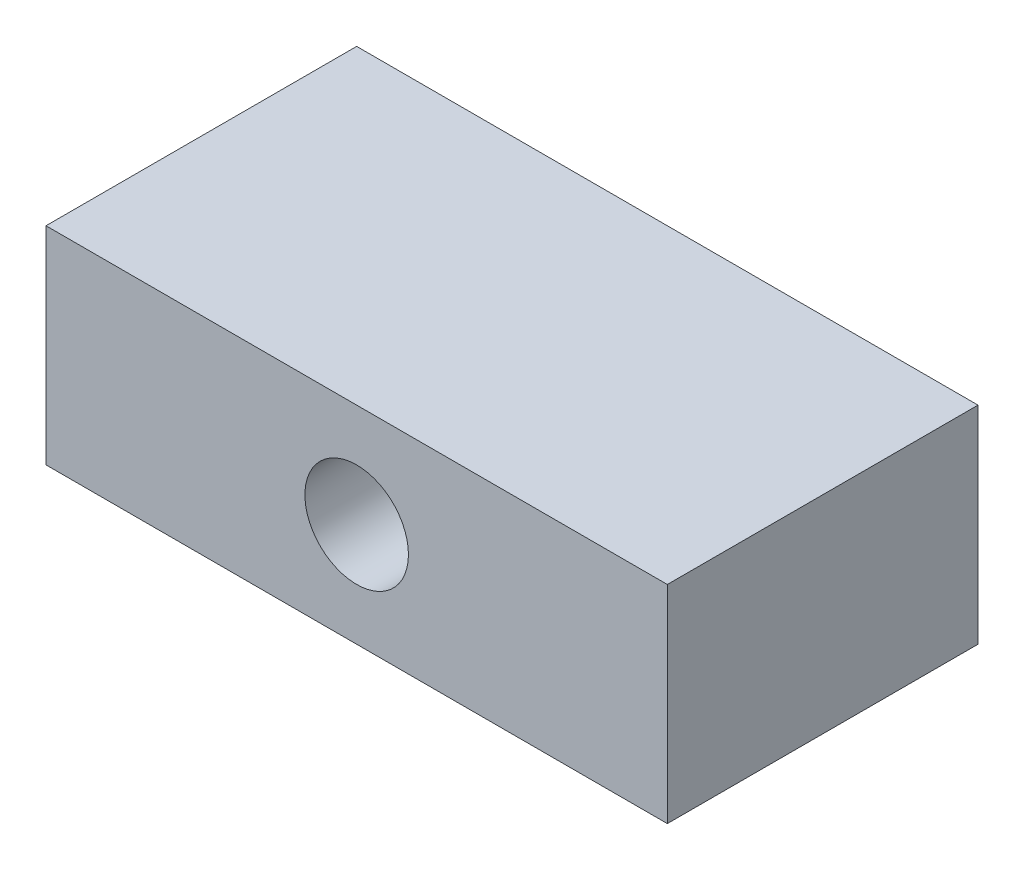
from build123d import *

# Parameters (mm, degrees)
SKETCH1_W           = 300
SKETCH1_H           = 150
BOSS_EXTRUDE1_DEPTH = 50
SKETCH2_R           = 25
CUT_EXTRUDE1_DEPTH  = 218.944947177


with BuildPart() as part:
    # Sketch1 → Boss-Extrude1 (new, symmetric)
    with BuildSketch(Plane(origin=(0, 0, 0), x_dir=(1, 0, 0), z_dir=(0, 1, 0))):
        Rectangle(SKETCH1_W, SKETCH1_H)
    extrude(amount=BOSS_EXTRUDE1_DEPTH, both=True)

    # Sketch2 → Cut-Extrude1 (cut, through all)
    with BuildSketch(Plane.XY.offset(75)):
        Circle(SKETCH2_R)
    extrude(amount=-CUT_EXTRUDE1_DEPTH, mode=Mode.SUBTRACT)


solid = part.part
